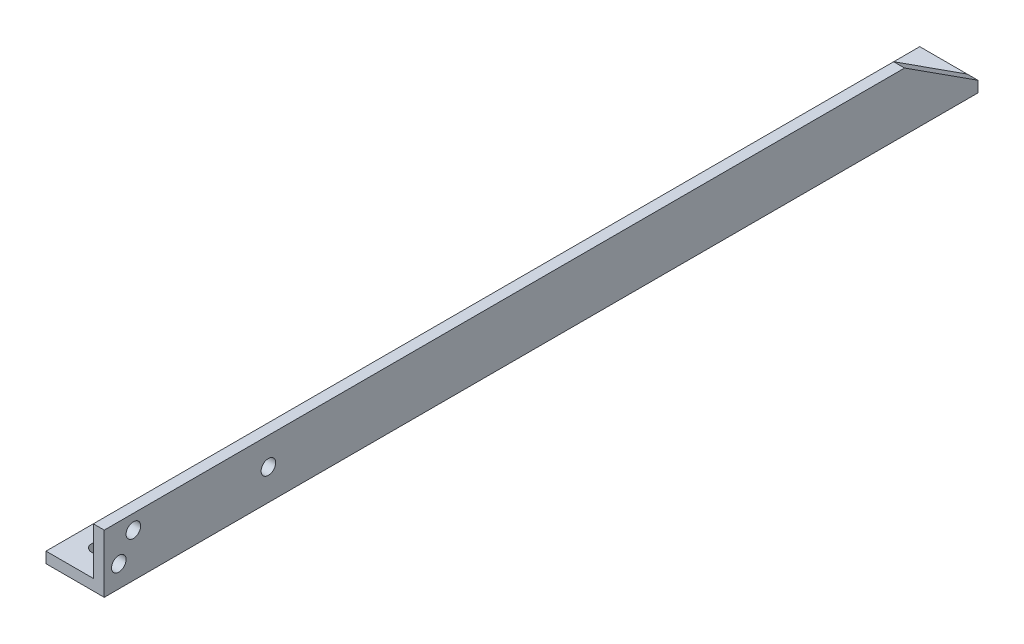
from build123d import *

# Parameters (mm, degrees)
BOSS_EXTRUDE1_DEPTH     = 381
CUT_EXTRUDE2_DEPTH      = 383.403015687
CUT_EXTRUDE2_DEPTH_BACK = 383.403015687
CUT_EXTRUDE3_REACH      = 384.403
SKETCH10_R              = 3.175
CUT_EXTRUDE4_REACH      = 384.69
SKETCH11_R              = 3.175
CUT_EXTRUDE5_REACH      = 384.403
SKETCH12_R              = 3.175


with BuildPart() as part:
    # Sketch1 → Boss-Extrude1 (new body)
    with BuildSketch(Plane.XY):
        Polygon((0, 0), (0, -25.4), (-25.4, -25.4), (-25.4, -20.6375), (-4.7625, -20.6375), (-4.7625, 0), align=None)
    extrude(amount=BOSS_EXTRUDE1_DEPTH)

    # Sketch9 → Cut-Extrude2 (cut, two sides: drawn at the far end of the back side and taken through both)
    with BuildSketch(Plane.ZY.offset(4.7625).offset(-CUT_EXTRUDE2_DEPTH_BACK)):
        Polygon((-649.877066877, -439.409233154), (0, -20.6375), (32.02660759, 0), (681.903674467, 418.771733154), (-155.63979184, 1718.525866908), (-1487.420533185, 860.3449006), align=None)
    extrude(amount=CUT_EXTRUDE2_DEPTH + CUT_EXTRUDE2_DEPTH_BACK, mode=Mode.SUBTRACT)

    # Sketch10 → Cut-Extrude3 (cut, up to next)
    with BuildSketch(Plane.ZY.offset(4.7625), mode=Mode.PRIVATE) as cut_extrude3_sk1:
        with Locations((374.65, -15.875)):
            Circle(SKETCH10_R)
    cut_extrude3_tool1 = extrude(cut_extrude3_sk1.sketch, amount=-CUT_EXTRUDE3_REACH, mode=Mode.PRIVATE) & part.part
    # Sketch10 → Cut-Extrude3 (cut, up to next)
    with BuildSketch(Plane.ZY.offset(4.7625), mode=Mode.PRIVATE) as cut_extrude3_sk2:
        with Locations((368.3, -6.35)):
            Circle(SKETCH10_R)
    cut_extrude3_tool2 = extrude(cut_extrude3_sk2.sketch, amount=-CUT_EXTRUDE3_REACH, mode=Mode.PRIVATE) & part.part
    add(cut_extrude3_tool1.solids().sort_by_distance((-4.7625, -15.875, 374.65))[0], mode=Mode.SUBTRACT)
    add(cut_extrude3_tool2.solids().sort_by_distance((-4.7625, -6.35, 368.3))[0], mode=Mode.SUBTRACT)

    # Sketch11 → Cut-Extrude4 (cut, up to next)
    with BuildSketch(Plane(origin=(0, 0, 0), x_dir=(0, 0, -1), z_dir=(1, 0, 0)), mode=Mode.PRIVATE) as cut_extrude4_sk1:
        with Locations((-309.430322971, -11.929615818)):
            Circle(SKETCH11_R)
    cut_extrude4_tool1 = extrude(cut_extrude4_sk1.sketch, amount=-CUT_EXTRUDE4_REACH, mode=Mode.PRIVATE) & part.part
    add(cut_extrude4_tool1.solids().sort_by_distance((0, -11.929616, 309.430323))[0], mode=Mode.SUBTRACT)

    # Sketch12 → Cut-Extrude5 (cut, up to next)
    with BuildSketch(Plane(origin=(0, -20.6375, 0), x_dir=(1, 0, 0), z_dir=(0, 1, 0)), mode=Mode.PRIVATE) as cut_extrude5_sk1:
        with Locations((-15.08125, -368.3)):
            Circle(SKETCH12_R)
    cut_extrude5_tool1 = extrude(cut_extrude5_sk1.sketch, amount=-CUT_EXTRUDE5_REACH, mode=Mode.PRIVATE) & part.part
    add(cut_extrude5_tool1.solids().sort_by_distance((-15.08125, -20.6375, 368.3))[0], mode=Mode.SUBTRACT)


solid = part.part
